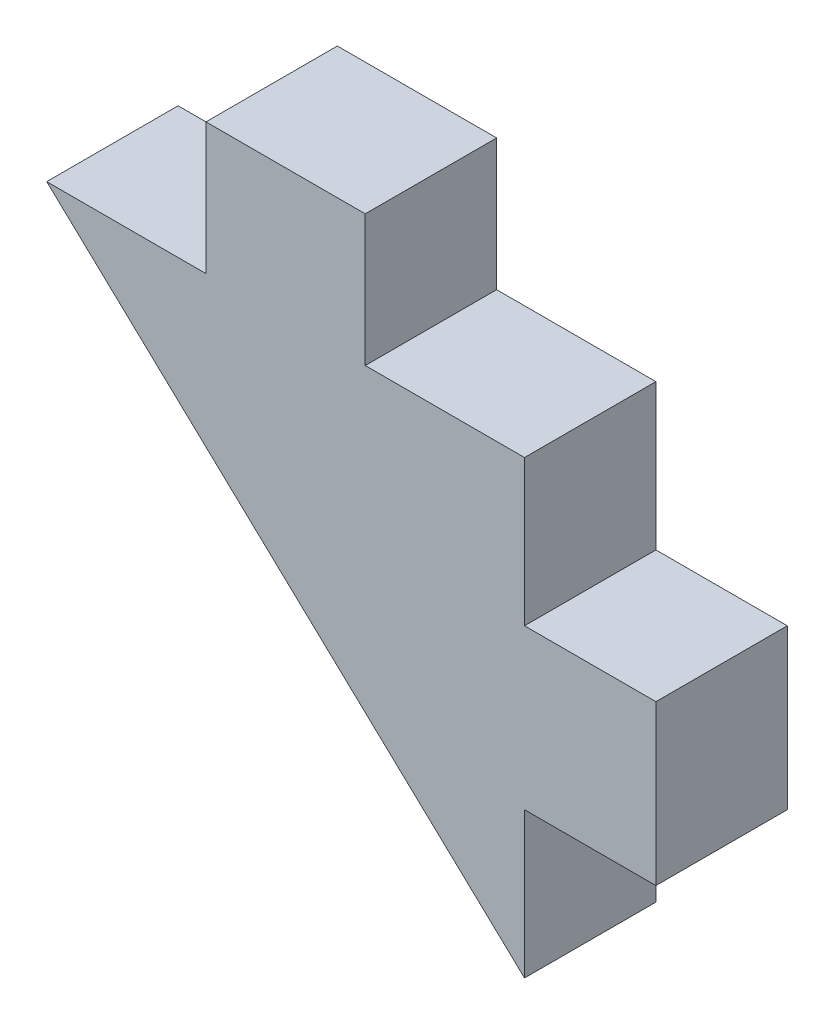
from build123d import *

# Parameters (mm, degrees)
BOSS_EXTRUDE1_DEPTH = 5.5


with BuildPart() as part:
    # Sketch1 → Boss-Extrude1 (new body)
    with BuildSketch(Plane.XY):
        Polygon((-10, 9.433962264), (10, -9.433962264), (10, -3.333333333), (15.5, -3.333333333), (15.5, 3.333333333), (10, 3.333333333), (10, 9.433962264), (3.333333333, 9.433962264), (3.333333333, 14.933962264), (-3.333333333, 14.933962264), (-3.333333333, 9.433962264), align=None)
    extrude(amount=BOSS_EXTRUDE1_DEPTH)


solid = part.part
